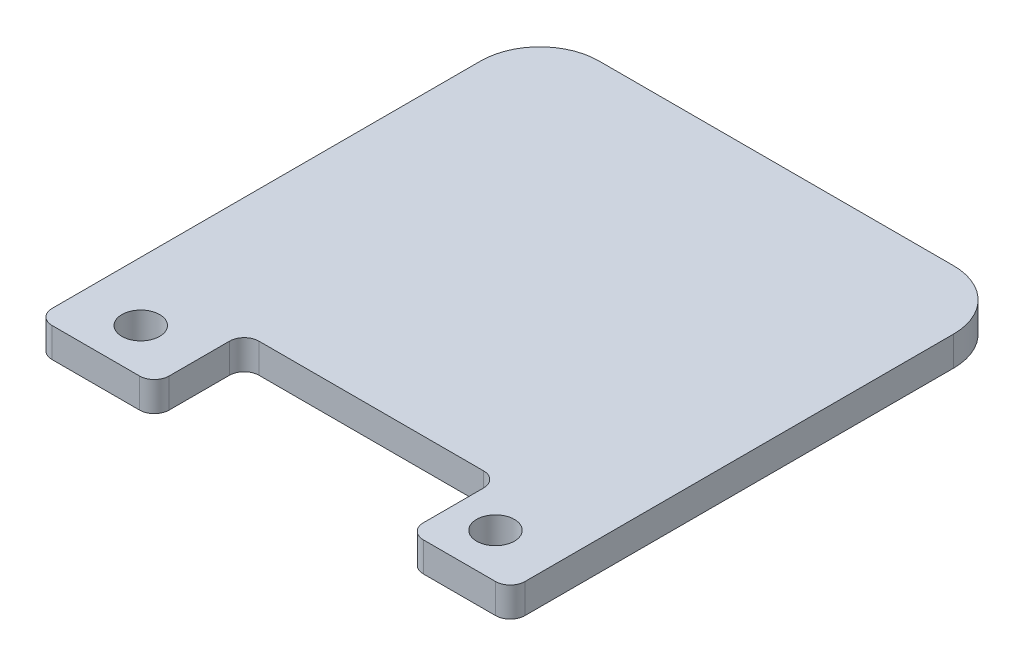
from build123d import *

# Parameters (mm, degrees)
SKETCH1_W           = 50.8
SKETCH1_H           = 53.975
BOSS_EXTRUDE1_DEPTH = 3.175
SKETCH2_R           = 2.032
CUT_EXTRUDE1_DEPTH  = 38.196314082
SKETCH3_W           = 27.305
SKETCH3_H           = 9.652
CUT_EXTRUDE2_DEPTH  = 38.196314082
FILLET1_R           = 1.5875
FILLET2_R           = 6.35


with BuildPart() as part:
    # Sketch1 → Boss-Extrude1 (new body)
    with BuildSketch(Plane(origin=(0, 0, 0), x_dir=(1, 0, 0), z_dir=(0, 1, 0))):
        Rectangle(SKETCH1_W, SKETCH1_H)
    extrude(amount=BOSS_EXTRUDE1_DEPTH)

    # Sketch2 → Cut-Extrude1 (cut, through all)
    with BuildSketch(Plane(origin=(0, 0, 0), x_dir=(-1, 0, 0), z_dir=(0, -1, 0))):
        with Locations((-19.05, -22.225)):
            Circle(SKETCH2_R)
        with Locations((19.05, -22.225)):
            Circle(SKETCH2_R)
    extrude(amount=-CUT_EXTRUDE1_DEPTH, mode=Mode.SUBTRACT)

    # Sketch3 → Cut-Extrude2 (cut, through all)
    with BuildSketch(Plane(origin=(0, 3.175, 0), x_dir=(1, 0, 0), z_dir=(0, 1, 0))):
        with Locations((0.8255, -22.1615)):
            Rectangle(SKETCH3_W, SKETCH3_H)
    extrude(amount=-CUT_EXTRUDE2_DEPTH, mode=Mode.SUBTRACT)

    # Fillet1
    fillet1_edges = [part.edges().sort_by_distance(p)[0] for p in [
        (-25.4, 1.5875, 26.9875),
        (-12.827, 1.5875, 26.9875),
        (-12.827, 1.5875, 17.3355),
        (14.478, 1.5875, 17.3355),
        (14.478, 1.5875, 26.9875),
        (25.4, 1.5875, 26.9875),
    ]]
    fillet(fillet1_edges, radius=FILLET1_R)

    # Fillet2
    fillet2_edges = [part.edges().sort_by_distance(p)[0] for p in [
        (-25.4, 1.5875, -26.9875),
        (25.4, 1.5875, -26.9875),
    ]]
    fillet(fillet2_edges, radius=FILLET2_R)


solid = part.part
